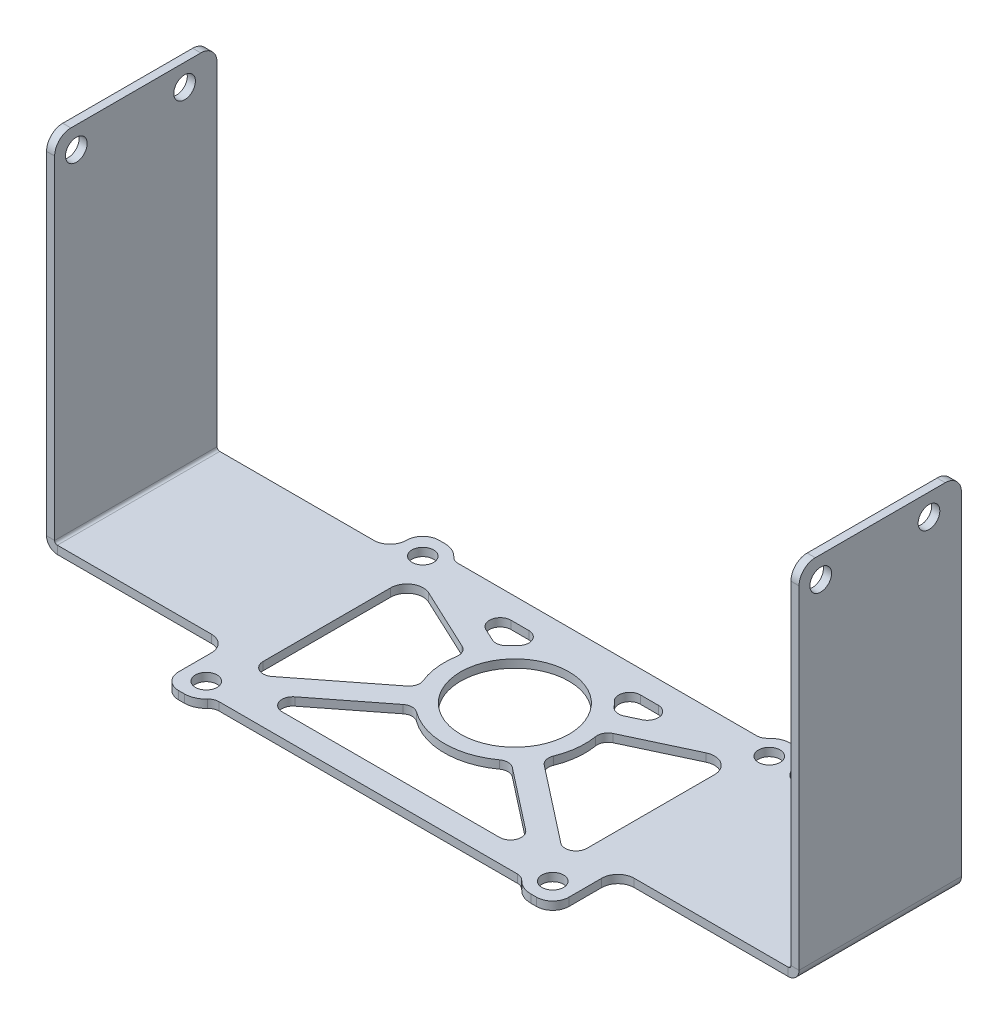
from build123d import *

# Parameters (mm, degrees)
SKETCH5_W                    = 136
SKETCH5_H                    = 30
BASE_FLANGE1_DEPTH           = 1.5
EDGE_FLANGE1_STRIP_W         = 7
EDGE_FLANGE1_STRIP_H         = 1.5
EDGE_FLANGE1_STRIP_CUT_DEPTH = 30
EDGE_FLANGE1_DEPTH           = 30
SKETCH13_R                   = 2
CUT_EXTRUDE1_DEPTH           = 10
SKETCH14_W                   = 72.1
SKETCH14_H                   = 48.1
SKETCH14_R                   = 2
BOSS_EXTRUDE1_DEPTH          = 1.5
SKETCH15_R                   = 10
CUT_EXTRUDE2_DEPTH           = 10
FILLET1_R                    = 3
CUT_EXTRUDE5_DEPTH           = 10
FILLET4_R                    = 2
BOSS_EXTRUDE2_DEPTH          = 1.5


# Sheet-metal steps are written as plain solids
with BuildPart() as part:
    # Sketch5 → Base-Flange1 (new body)
    with BuildSketch(Plane(origin=(0, 0, 0), x_dir=(1, 0, 0), z_dir=(0, 1, 0))):
        with Locations((-68, 15)):
            Rectangle(SKETCH5_W, SKETCH5_H)
    extrude(amount=-BASE_FLANGE1_DEPTH)

    # Edge-Flange1 strip (across the edge) → Edge-Flange1 strip cut (cut)
    with BuildSketch(Plane(origin=(-136, 0, -30), x_dir=(1, 0, 0), z_dir=(0, 0, 1))):
        with Locations((-3, -0.75)):
            Rectangle(EDGE_FLANGE1_STRIP_W, EDGE_FLANGE1_STRIP_H)
    edge_flange1_strip_cut = extrude(amount=EDGE_FLANGE1_STRIP_CUT_DEPTH, mode=Mode.SUBTRACT)

    # Edge-Flange1 section (across the edge) → Edge-Flange1 (add)
    with BuildSketch(Plane(origin=(-136, 0, -30), x_dir=(1, 0, 0), z_dir=(0, 0, 1))):
        with BuildLine():
            Line((-1.5, 0.5), (-1.5, 65))
            Line((-1.5, 65), (0, 65))
            Line((0, 65), (0, 0.5))
            ThreePointArc((0, 0.5), (0.146446609, 0.146446609), (0.5, 0))
            Line((0.5, 0), (0.5, -1.5))
            ThreePointArc((0.5, -1.5), (-0.914213562, -0.914213562), (-1.5, 0.5))
        make_face()
    edge_flange1 = extrude(amount=EDGE_FLANGE1_DEPTH)

    # Sketch13 → Cut-Extrude1 (cut)
    with BuildSketch(Plane.ZY.offset(137.5)):
        with Locations(Location((-24, 61, 0), (0, 0, 270))):
            Circle(SKETCH13_R)
        with Locations(Location((-4, 61, 0), (0, 0, 270))):
            Circle(SKETCH13_R)
    cut_extrude1 = extrude(amount=-CUT_EXTRUDE1_DEPTH, mode=Mode.SUBTRACT)

    # Mirror1: Edge-Flange1 strip cut, Edge-Flange1, Cut-Extrude1 across plane
    add(edge_flange1_strip_cut.mirror(Plane(origin=(-68, 0, 0), x_dir=(0, 0, 1), z_dir=(1, 0, 0))), mode=Mode.SUBTRACT)
    add(edge_flange1.mirror(Plane(origin=(-68, 0, 0), x_dir=(0, 0, 1), z_dir=(1, 0, 0))))
    add(cut_extrude1.mirror(Plane(origin=(-68, 0, 0), x_dir=(0, 0, 1), z_dir=(1, 0, 0))), mode=Mode.SUBTRACT)

    # Sketch14 → Boss-Extrude1 (add)
    with BuildSketch(Plane.XZ.offset(1.5)):
        with Locations((-68, -12)):
            Rectangle(SKETCH14_W, SKETCH14_H)
        with Locations(Location((-100, 8, 0), (0, 0, 270))):
            Circle(SKETCH14_R, mode=Mode.SUBTRACT)
        with Locations(Location((-100, -32, 0), (0, 0, 90))):
            Circle(SKETCH14_R, mode=Mode.SUBTRACT)
        with Locations(Location((-36, -32, 0), (0, 0, 270))):
            Circle(SKETCH14_R, mode=Mode.SUBTRACT)
        with Locations(Location((-36, 8, 0), (0, 0, 90))):
            Circle(SKETCH14_R, mode=Mode.SUBTRACT)
    extrude(amount=-BOSS_EXTRUDE1_DEPTH)

    # Sketch15 → Cut-Extrude2 (cut)
    with BuildSketch(Plane.XZ.offset(1.5)):
        with Locations(Location((-68, -17, 0), (0, 0, 270))):
            Circle(SKETCH15_R)
    extrude(amount=-CUT_EXTRUDE2_DEPTH, mode=Mode.SUBTRACT)

    # Fillet1
    fillet1_edges = [part.edges().sort_by_distance(p)[0] for p in [
        (-31.95, -0.75, 0),
        (-104.05, -0.75, 0),
        (-104.05, -0.75, -30),
        (-104.05, -0.75, -36.05),
        (-31.95, -0.75, -30),
        (-104.05, -0.75, 12.05),
        (-31.95, -0.75, 12.05),
        (-31.95, -0.75, -36.05),
        (-136.75, 65, -30),
        (-136.75, 65, 0),
        (0.75, 65, 0),
        (0.75, 65, -30),
    ]]
    fillet(fillet1_edges, radius=FILLET1_R)

    # Sketch16 → Cut-Extrude5 (cut)
    with BuildSketch(Plane(origin=(0, 0, 0), x_dir=(1, 0, 0), z_dir=(0, 1, 0))):
        with BuildLine():
            ThreePointArc((-97.755689719, 28.628713693), (-97.827360667, 28.582085676), (-97.9, 28.536981086))
            Line((-97.9, 28.536981086), (-97.9, -3.694482809))
            Line((-97.9, -3.694482809), (-79.402624763, 10.756591595))
            ThreePointArc((-79.402624763, 10.756591595), (-80.917918539, 15.541445711), (-80.507682349, 20.543710239))
            Line((-80.507682349, 20.543710239), (-97.755689719, 28.628713693))
        make_face()
        with BuildLine():
            Line((-69.609347694, 29.9), (-90.572232827, 29.9))
            Line((-90.572232827, 29.9), (-78.725060069, 24.34663777))
            ThreePointArc((-78.725060069, 24.34663777), (-74.763457823, 28.102055588), (-69.609347694, 29.9))
        make_face()
        with BuildLine():
            Line((-57.274939931, 24.34663777), (-45.427767173, 29.9))
            Line((-45.427767173, 29.9), (-66.390652306, 29.9))
            ThreePointArc((-66.390652306, 29.9), (-61.236542177, 28.102055588), (-57.274939931, 24.34663777))
        make_face()
        with BuildLine():
            Line((-36, 36.05), (-99.999999884, 36.05))
            ThreePointArc((-99.999999884, 36.05), (-98.012853754, 35.528987078), (-96.536981086, 34.1))
            Line((-96.536981086, 34.1), (-39.463018914, 34.1))
            ThreePointArc((-39.463018914, 34.1), (-37.987146195, 35.528987107), (-36, 36.05))
        make_face()
        with BuildLine():
            Line((-38.1, -3.694482809), (-38.1, 28.536981086))
            ThreePointArc((-38.1, 28.536981086), (-38.172639333, 28.582085676), (-38.244310281, 28.628713693))
            Line((-38.244310281, 28.628713693), (-55.492317651, 20.543710239))
            ThreePointArc((-55.492317651, 20.543710239), (-55.123667631, 18.788872475), (-55, 17))
            ThreePointArc((-55, 17), (-55.405673461, 13.777743176), (-56.597375237, 10.756591595))
            Line((-56.597375237, 10.756591595), (-38.1, -3.694482809))
        make_face()
        with BuildLine():
            ThreePointArc((-59.183080213, 7.446889225), (-68, 4), (-76.816919787, 7.446889225))
            Line((-76.816919787, 7.446889225), (-93.900937995, -5.9))
            Line((-93.900937995, -5.9), (-42.099062005, -5.9))
            Line((-42.099062005, -5.9), (-59.183080213, 7.446889225))
        make_face()
        with BuildLine():
            ThreePointArc((-96.536981086, -10.1), (-98.012853805, -11.528987107), (-100, -12.05))
            Line((-100, -12.05), (-36, -12.05))
            ThreePointArc((-36, -12.05), (-37.987146195, -11.528987107), (-39.463018914, -10.1))
            Line((-39.463018914, -10.1), (-96.536981086, -10.1))
        make_face()
    extrude(amount=-CUT_EXTRUDE5_DEPTH, mode=Mode.SUBTRACT)

    # Fillet4
    fillet4_edges = [part.edges().sort_by_distance(p)[0] for p in [
        (-56.597375237, -0.75, -10.756591595),
        (-55.492317651, -0.75, -20.543710239),
        (-38.1, -0.75, 3.694482809),
        (-39.463018914, -0.75, -34.1),
        (-96.536981086, -0.75, -34.1),
        (-57.274939931, -0.75, -24.34663777),
        (-66.390652306, -0.75, -29.9),
        (-45.427767173, -0.75, -29.9),
        (-69.609347694, -0.75, -29.9),
        (-78.725060069, -0.75, -24.34663777),
        (-90.572232827, -0.75, -29.9),
        (-76.816919787, -0.75, -7.446889225),
        (-59.183080213, -0.75, -7.446889225),
        (-42.099062005, -0.75, 5.9),
        (-93.900937995, -0.75, 5.9),
        (-96.536981086, -0.75, 10.1),
        (-39.463018914, -0.75, 10.1),
        (-80.507682349, -0.75, -20.543710239),
        (-79.402624763, -0.75, -10.756591595),
        (-97.9, -0.75, 3.694482809),
    ]]
    fillet(fillet4_edges, radius=FILLET4_R)

    # Sketch17 → Boss-Extrude2 (add)
    with BuildSketch(Plane(origin=(0, 0, 0), x_dir=(1, 0, 0), z_dir=(0, 1, 0))):
        with BuildLine():
            Line((-97.9, 28.536981086), (-97.9, 23.976872191))
            ThreePointArc((-97.9, 23.976872191), (-96.509362469, 26.50866058), (-93.626698371, 26.693248999))
            Line((-93.626698371, 26.693248999), (-97.755689719, 28.628713693))
            ThreePointArc((-97.755689719, 28.628713693), (-97.827360667, 28.582085676), (-97.9, 28.536981086))
        make_face()
        with BuildLine():
            Line((-38.244310281, 28.628713693), (-42.373301629, 26.693248999))
            ThreePointArc((-42.373301629, 26.693248999), (-39.490637531, 26.50866058), (-38.1, 23.976872191))
            Line((-38.1, 23.976872191), (-38.1, 28.536981086))
            ThreePointArc((-38.1, 28.536981086), (-38.172639333, 28.582085676), (-38.244310281, 28.628713693))
        make_face()
    extrude(amount=-BOSS_EXTRUDE2_DEPTH)


solid = part.part
